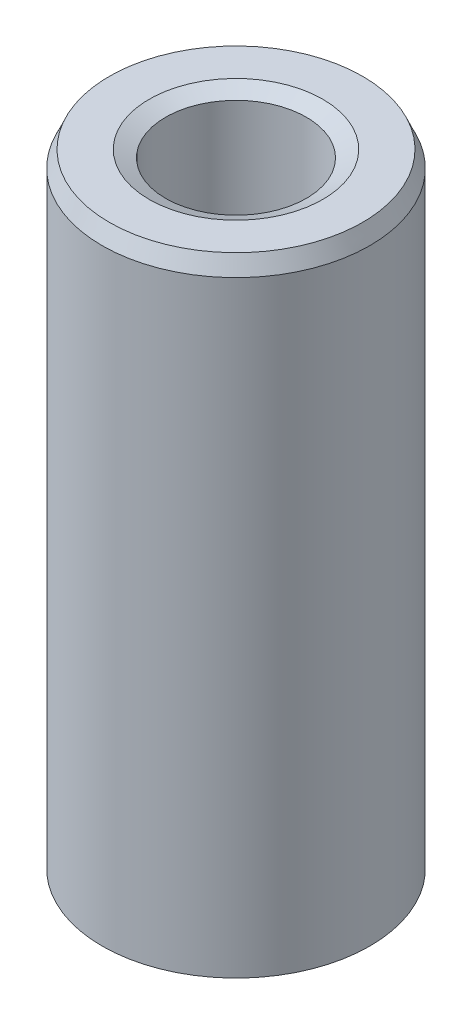
from build123d import *
from OCP.BRepFilletAPI import BRepFilletAPI_MakeChamfer

# Parameters (mm, degrees)
SKETCH1_R           = 25
BOSS_EXTRUDE1_DEPTH = 117.685645553
SKETCH2_R           = 13.140329815
CUT_EXTRUDE1_DEPTH  = 123.881695826
CHAMFER1_SIZE       = 3.068394399
CHAMFER1_SIZE2      = 1.365056544


with BuildPart() as part:
    # Sketch1 → Boss-Extrude1 (new body)
    with BuildSketch(Plane(origin=(0, 0, 0), x_dir=(1, 0, 0), z_dir=(0, 1, 0))):
        Circle(SKETCH1_R)
    extrude(amount=BOSS_EXTRUDE1_DEPTH)

    # Sketch2 → Cut-Extrude1 (cut, through all)
    with BuildSketch(Plane(origin=(0, 0, 0), x_dir=(1, 0, 0), z_dir=(0, 1, 0))):
        Circle(SKETCH2_R)
    extrude(amount=CUT_EXTRUDE1_DEPTH, mode=Mode.SUBTRACT)

    # Chamfer1: one chamfer whose edges measure the first distance from different faces: ONE call of the kernel's chamfer builder (chamfer() names one face for all edges)
    chamfer1_edges_1 = [part.edges().sort_by_distance(p)[0] for p in [
        (-13.140329815, 117.685645553, 0),
    ]]
    chamfer1_side_1 = [part.faces().sort_by_distance(p)[0] for p in [
        (-24.292893219, 117.685645553, 0),
    ]]
    chamfer1_edges_2 = [part.edges().sort_by_distance(p)[0] for p in [
        (-13.140329815, 0, 0),
    ]]
    chamfer1_side_2 = [part.faces().sort_by_distance(p)[0] for p in [
        (-13.140329815, 58.842822776, 0),
    ]]
    chamfer1_edges_3 = [part.edges().sort_by_distance(p)[0] for p in [
        (-25, 0, 0),
    ]]
    chamfer1_side_3 = [part.faces().sort_by_distance(p)[0] for p in [
        (-24.292893219, 0, 0),
    ]]
    chamfer1_edges_4 = [part.edges().sort_by_distance(p)[0] for p in [
        (-25, 117.685645553, 0),
    ]]
    chamfer1_side_4 = [part.faces().sort_by_distance(p)[0] for p in [
        (-25, 58.842822776, 0),
    ]]
    chamfer1 = BRepFilletAPI_MakeChamfer(part.part.solid().wrapped)
    for e in chamfer1_edges_1:
        chamfer1.Add(CHAMFER1_SIZE, CHAMFER1_SIZE2, e.wrapped, chamfer1_side_1[0].wrapped)  # the first distance lies on this face
    for e in chamfer1_edges_2:
        chamfer1.Add(CHAMFER1_SIZE, CHAMFER1_SIZE2, e.wrapped, chamfer1_side_2[0].wrapped)  # the first distance lies on this face
    for e in chamfer1_edges_3:
        chamfer1.Add(CHAMFER1_SIZE, CHAMFER1_SIZE2, e.wrapped, chamfer1_side_3[0].wrapped)  # the first distance lies on this face
    for e in chamfer1_edges_4:
        chamfer1.Add(CHAMFER1_SIZE, CHAMFER1_SIZE2, e.wrapped, chamfer1_side_4[0].wrapped)  # the first distance lies on this face
    add(Compound.cast(chamfer1.Shape()), mode=Mode.REPLACE)


solid = part.part
